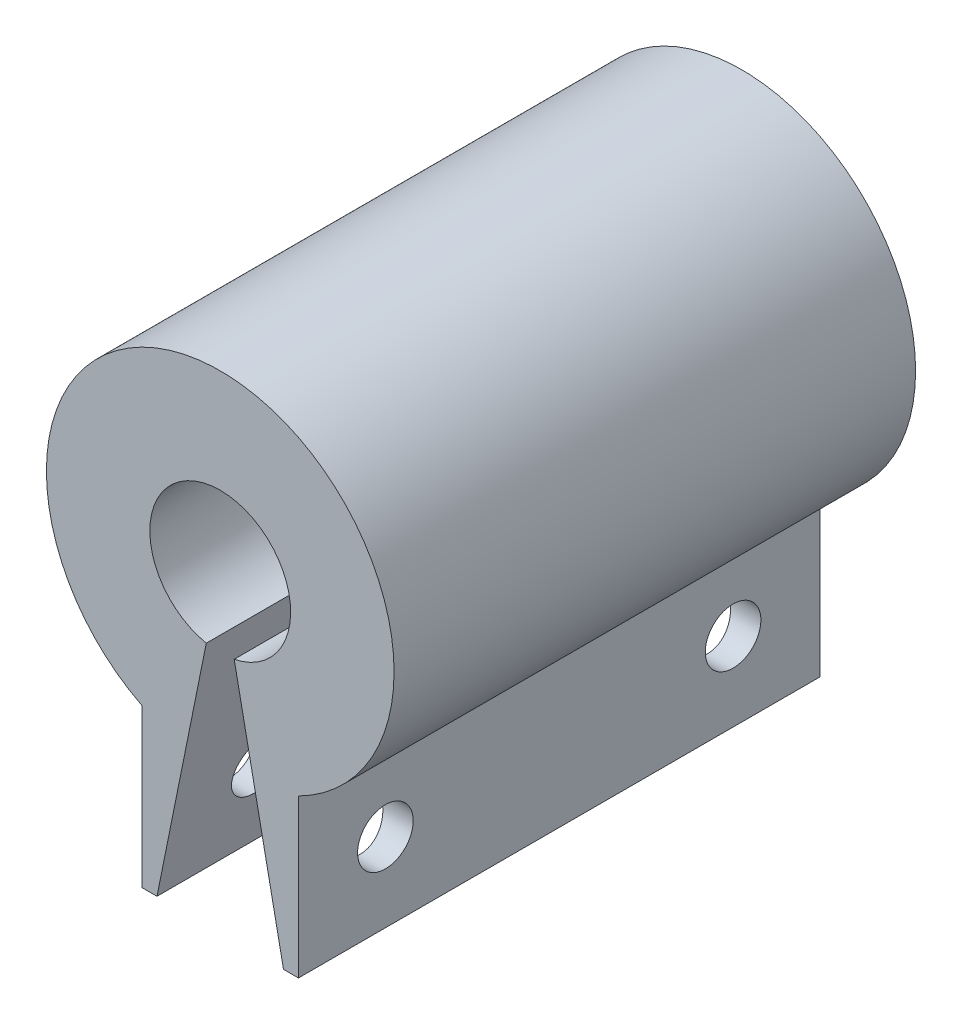
from build123d import *

# Parameters (mm, degrees)
EXTRUDE_1_DEPTH     = 30
SKETCH_2_R          = 4.05
CUT_EXTRUDE_1_DEPTH = 15
SKETCH_3_R          = 1.575
CUT_EXTRUDE_2_DEPTH = 15
SKETCH_10_R         = 1.6
CUT_EXTRUDE_8_DEPTH = 38.871493237
CUT_EXTRUDE_9_DEPTH = 37.386810797


with BuildPart() as part:
    # ｽｹｯﾁ1 → ﾎﾞｽ - 押し出し1 (new body)
    with BuildSketch(Plane.XY):
        with BuildLine():
            Line((-4.5, -8.93028555), (-4.5, -18))
            Line((-4.5, -18), (4.5, -18))
            Line((4.5, -18), (4.5, -8.93028555))
            ThreePointArc((4.5, -8.93028555), (0, 10), (-4.5, -8.93028555))
        make_face()
    extrude(amount=EXTRUDE_1_DEPTH)

    # ｽｹｯﾁ2 → ｶｯﾄ - 押し出し1 (cut)
    with BuildSketch(Plane.XY.offset(30)):
        Circle(SKETCH_2_R)
    extrude(amount=-CUT_EXTRUDE_1_DEPTH, mode=Mode.SUBTRACT)

    # ｽｹｯﾁ3 → ｶｯﾄ - 押し出し2 (cut)
    with BuildSketch(Plane(origin=(0, 0, 0), x_dir=(-1, 0, 0), z_dir=(0, 0, -1))):
        Circle(SKETCH_3_R)
    extrude(amount=-CUT_EXTRUDE_2_DEPTH, mode=Mode.SUBTRACT)

    # ｽｹｯﾁ10 → ｶｯﾄ - 押し出し8 (cut, through all)
    with BuildSketch(Plane(origin=(4.5, 0, 0), x_dir=(0, 0, -1), z_dir=(1, 0, 0))):
        with Locations((-25, -13.465142775)):
            Circle(SKETCH_10_R)
        with Locations((-5, -13.465142775)):
            Circle(SKETCH_10_R)
    extrude(amount=-CUT_EXTRUDE_8_DEPTH, mode=Mode.SUBTRACT)

    # ｽｹｯﾁ4 → ｶｯﾄ - 押し出し9 (cut, through all)
    with BuildSketch(Plane.XY.offset(30)):
        with BuildLine():
            Line((-0.312080176, -1.543771668), (-3.638778503, -18))
            ThreePointArc((-3.638778503, -18), (0, -18.364114708), (3.638778503, -18))
            Line((3.638778503, -18), (0.312080176, -1.543771668))
            ThreePointArc((0.312080176, -1.543771668), (0, -1.575), (-0.312080176, -1.543771668))
        make_face()
    extrude(amount=-CUT_EXTRUDE_9_DEPTH, mode=Mode.SUBTRACT)


solid = part.part
